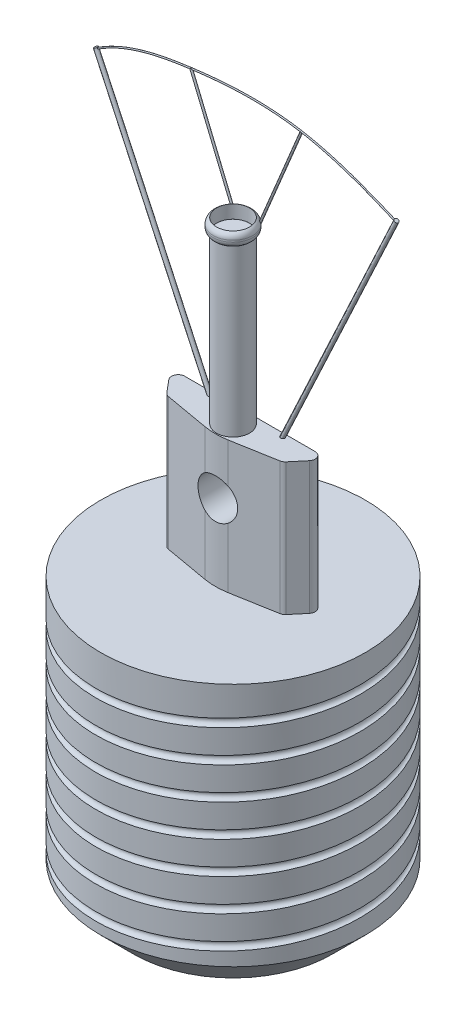
from build123d import *

# Parameters (mm, degrees)
SKETCH1_R           = 20
BOSS_EXTRUDE1_DEPTH = 40
CUT_SWEEP1_PITCH    = 4.875
SKETCH4_R           = 20
BOSS_EXTRUDE2_DEPTH = 2
BOSS_EXTRUDE3_DEPTH = 20
SKETCH6_R           = 3
CUT_EXTRUDE1_DEPTH  = 69.93969835
SKETCH7_R           = 2.5
BOSS_EXTRUDE4_DEPTH = 25
SKETCH8_R           = 3
SKETCH8_R_2         = 2.5
BOSS_EXTRUDE5_DEPTH = 2
FILLET3_R           = 10
FILLET1_R           = 1
SKETCH11_R          = 0.3
SKETCH14_R          = 4
BOSS_EXTRUDE6_DEPTH = 3
CHAMFER1_SIZE       = 5
SKETCH16_R          = 0.15
SKETCH18_R          = 0.1
CHAMFER2_SIZE       = 2
FILLET4_R           = 1


with BuildPart() as part:
    # Sketch1 → Boss-Extrude1 (new body)
    with BuildSketch(Plane(origin=(0, 0, 0), x_dir=(1, 0, 0), z_dir=(0, 1, 0))):
        with Locations(Location((0, 0, 0), (0, 0, 270))):
            Circle(SKETCH1_R)
    extrude(amount=BOSS_EXTRUDE1_DEPTH)

    # Cut-Sweep1: the profile of Sketch3 screwed along a right-hand helix of 8 turns, 12 arcs to a turn; built about Z, then put on its axis
    cut_sweep1_z = Axis((0, 0, 0), (0, 0, 1))
    cut_sweep1_corners = [(20.625, 0, 0), (20, 0.024848298, -0.624505854), (19.375, 0, 0), (20, -0.024848298, 0.624505854)]
    with BuildLine(mode=Mode.PRIVATE) as cut_sweep1_profile:
        ThreePointArc((20.625, 0, 0), (20.441941738, 0.0175704, -0.441592324), (20, 0.024848298, -0.624505854))
        ThreePointArc((20, 0.024848298, -0.624505854), (19.558058262, 0.0175704, -0.441592324), (19.375, 0, 0))
        ThreePointArc((19.375, 0, 0), (19.558058262, -0.0175704, 0.441592324), (20, -0.024848298, 0.624505854))
        ThreePointArc((20, -0.024848298, 0.624505854), (20.441941738, -0.0175704, 0.441592324), (20.625, 0, 0))
    cut_sweep1_cap = Face(cut_sweep1_profile.wire())
    cut_sweep1_arcs = [((20.625, 0, 0), (20.625, 0.024848298, -0.624505854), (20, 0.024848298, -0.624505854), (1, 0.7071067811865475, 1)), ((20, 0.024848298, -0.624505854), (19.375, 0.024848298, -0.624505854), (19.375, 0, 0), (1, 0.7071067811865475, 1)), ((19.375, 0, 0), (19.375, -0.024848298, 0.624505854), (20, -0.024848298, 0.624505854), (1, 0.7071067811865475, 1)), ((20, -0.024848298, 0.624505854), (20.625, -0.024848298, 0.624505854), (20.625, 0, 0), (1, 0.7071067811865475, 1))]  # start, shoulder, end, weights
    cut_sweep1_turn_angles = [0, 15, 30, 45, 60, 75, 90, 105, 120, 135, 150, 165, 180, 195, 210, 225, 240, 255, 270, 285, 300, 315, 330, 345, 360]
    cut_sweep1_turn_weights = [1, 0.9659258262890683, 1, 0.9659258262890683, 1, 0.9659258262890683, 1, 0.9659258262890683, 1, 0.9659258262890683, 1, 0.9659258262890683, 1, 0.9659258262890683, 1, 0.9659258262890683, 1, 0.9659258262890683, 1, 0.9659258262890683, 1, 0.9659258262890683, 1, 0.9659258262890683, 1]
    cut_sweep1_turn_sides = [Face.make_bezier_surface([[Vector(p[j][0], p[j][1], 0).rotate(cut_sweep1_z, cut_sweep1_turn_angles[2 * i + k]) / cut_sweep1_turn_weights[2 * i + k] + Vector(0, 0, p[j][2] + CUT_SWEEP1_PITCH * cut_sweep1_turn_angles[2 * i + k] / 360) for k in range(3)] for j in range(3)], [[p[3][j] * cut_sweep1_turn_weights[2 * i + k] for k in range(3)] for j in range(3)]) for p in cut_sweep1_arcs for i in range(12)]
    cut_sweep1 = Plane(origin=(0, 40, 0), x_dir=(-1, 0, 0), z_dir=(0, -1, 0)) * Solid(Shell([*[p.moved(Location((0, 0, CUT_SWEEP1_PITCH * i))) for i in range(8) for p in cut_sweep1_turn_sides], cut_sweep1_cap, cut_sweep1_cap.rotate(cut_sweep1_z, 2880).moved(Location((0, 0, CUT_SWEEP1_PITCH * 2880 / 360)))]))
    add(cut_sweep1, mode=Mode.SUBTRACT)

    # Sketch4 → Boss-Extrude2 (add)
    with BuildSketch(Plane(origin=(0, 40, 0), x_dir=(1, 0, 0), z_dir=(0, 1, 0))):
        with Locations(Location((0, 0, 0), (0, 0, 270))):
            Circle(SKETCH4_R)
    extrude(amount=BOSS_EXTRUDE2_DEPTH)

    # Sketch5 → Boss-Extrude3 (add)
    with BuildSketch(Plane(origin=(0, 42, 0), x_dir=(1, 0, 0), z_dir=(0, 1, 0))):
        with BuildLine():
            Line((9.855493079, 2.553979695), (-9.855493079, 2.553979695))
            ThreePointArc((-9.855493079, 2.553979695), (-10.761800867, 1.976597957), (-10.621537523, 0.911192085))
            Line((-10.621537523, 0.911192085), (-9.020017508, -0.997425145))
            ThreePointArc((-9.020017508, -0.997425145), (-8.753973065, -1.220662939), (-8.427621243, -1.339445289))
            Line((-8.427621243, -1.339445289), (0, -2.825462297))
            Line((0, -2.825462297), (8.427621243, -1.339445289))
            ThreePointArc((8.427621243, -1.339445289), (8.753973065, -1.220662939), (9.020017508, -0.997425145))
            Line((9.020017508, -0.997425145), (10.621537523, 0.911192085))
            ThreePointArc((10.621537523, 0.911192085), (10.761800867, 1.976597957), (9.855493079, 2.553979695))
        make_face()
    extrude(amount=BOSS_EXTRUDE3_DEPTH)

    # Sketch6 → Cut-Extrude1 (cut, through all)
    with BuildSketch(Plane(origin=(0, 0, -2.553979695), x_dir=(-1, 0, 0), z_dir=(0, 0, -1))):
        with Locations((0, 53.52029527)):
            Circle(SKETCH6_R)
    extrude(amount=-CUT_EXTRUDE1_DEPTH, mode=Mode.SUBTRACT)

    # Sketch7 → Boss-Extrude4 (add)
    with BuildSketch(Plane(origin=(0, 62, 0), x_dir=(1, 0, 0), z_dir=(0, 1, 0))):
        with Locations(Location((0, 0, 0), (0, 0, 270))):
            Circle(SKETCH7_R)
    extrude(amount=BOSS_EXTRUDE4_DEPTH)

    # Fillet3
    fillet3_edges = [part.edges().sort_by_distance(p)[0] for p in [
        (0, 46.260147635, 2.825462297),
        (0, 59.260147635, 2.825462297),
    ]]
    fillet(fillet3_edges, radius=FILLET3_R)

    # Sweep1: sweep along a path in Sketch10
    with BuildLine(Plane.XY.offset(-2)) as sweep1_path:
        Line((-4.417969366, 59.661911839), (-22.732460557, 98.937464943))
    # Sketch11 → Sweep1 (sweep)
    with BuildSketch(Plane(origin=(-22.732460557, 98.937464943, -2), x_dir=(0.9063077870366525, 0.42261826174069395, 0), z_dir=(-0.42261826174069395, 0.9063077870366525, 0))):
        Circle(SKETCH11_R)
    sweep1 = sweep(path=sweep1_path.line)

    # Mirror1: Sweep1 across plane
    add(sweep1.mirror(Plane(origin=(0, 0, 0), x_dir=(0, 0, 1), z_dir=(1, 0, 0))))

    # Sketch14 → Boss-Extrude6 (add)
    with BuildSketch(Plane.XZ):
        with Locations(Location((0, 0, 0), (0, 0, 90))):
            Circle(SKETCH14_R)
    extrude(amount=BOSS_EXTRUDE6_DEPTH)

    # Chamfer1
    # the kernel refuses this chamfer: 5 mm, written as the material it takes off along each edge
    with BuildSketch(Plane(origin=(0, 0, 0), x_dir=(0, 0, 1), z_dir=(-1, 0, 0))) as chamfer1_piece_1:
        Polygon((20, CHAMFER1_SIZE), (20 - CHAMFER1_SIZE, 0), (20, 0), align=None)
    revolve(axis=Axis((0, 0, 0), (0, 1, 0)), mode=Mode.SUBTRACT)

    # Sweep6: sweep along a path in Sketch17
    with BuildLine() as sweep6_path:  # in the path sketch's own coordinates; laid on its plane below (add() does not lay a ready-made edge on the line's plane)
        add(Edge.make_bspline(
            [(-22.677657355, 98.7761759), (-18.410883671, 101.6335652), (-8.009838198, 103.805909791), (7.885759174, 104.639553389), (18.025435265, 100.750522625), (22.64813584, 98.7761759)],
            knots=[0, 0, 0, 0, 0.31992603, 0.676007403, 1, 1, 1, 1], degree=3))
    # Sketch18 → Sweep6 (sweep)
    with BuildSketch(Plane(origin=(-22.677657355, 98.7761759, -2), x_dir=(0, 0, -1), z_dir=(0.8308914410553971, 0.5564345542657155, 0))):
        Circle(SKETCH18_R)
    sweep(path=Plane.XY.offset(-2) * sweep6_path.line)

    # Chamfer2
    chamfer2_edges = [part.edges().sort_by_distance(p)[0] for p in [
        (0, -3, -4),
    ]]
    chamfer(chamfer2_edges, length=CHAMFER2_SIZE)

    # Fillet4
    fillet4_edges = [part.edges().sort_by_distance(p)[0] for p in [
        (0, -3, -2),
    ]]
    fillet(fillet4_edges, radius=FILLET4_R)


with BuildPart() as body_2:
    # Sketch8 → Boss-Extrude5 (new body)
    with BuildSketch(Plane(origin=(0, 87, 0), x_dir=(1, 0, 0), z_dir=(0, 1, 0))):
        with Locations(Location((0, 0, 0), (0, 0, 270))):
            Circle(SKETCH8_R)
        with Locations(Location((0, 0, 0), (0, 0, 270))):
            Circle(SKETCH8_R_2, mode=Mode.SUBTRACT)
    extrude(amount=BOSS_EXTRUDE5_DEPTH)

    # Fillet1
    # the kernel refuses this fillet: 1 mm, written as the material it takes off along each edge
    with BuildSketch(Plane(origin=(0, 87, 0), x_dir=(0, 0, 1), z_dir=(-1, 0, 0))) as fillet1_piece_1:
        with BuildLine():
            CenterArc((2, 0.866025404), FILLET1_R, 300, 60)
            Line((2.5, 0), (2.51, -0.017320508))
            ThreePointArc((2.51, -0.017320508), (2.75, -0.02), (3, -0.02))
            Line((3, -0.02), (3.02, 0))
            Line((3.02, 0), (3.02, 0.866025404))
            Line((3.02, 0.866025404), (3, 0.866025404))
        make_face()
    revolve(axis=Axis((0, 87, 0), (0, 1, 0)), mode=Mode.SUBTRACT)
    with BuildSketch(Plane(origin=(0, 89, 0), x_dir=(0, 0, 1), z_dir=(-1, 0, 0))) as fillet1_piece_2:
        with BuildLine():
            CenterArc((2, -0.866025404), FILLET1_R, 0, 60)
            Line((2.5, 0), (2.51, 0.017320508))
            ThreePointArc((2.51, 0.017320508), (2.75, 0.02), (3, 0.02))
            Line((3, 0.02), (3.02, 0))
            Line((3.02, 0), (3.02, -0.866025404))
            Line((3.02, -0.866025404), (3, -0.866025404))
        make_face()
    revolve(axis=Axis((0, 89, 0), (0, 1, 0)), mode=Mode.SUBTRACT)

    # Sweep2: sweep along a path in Sketch15
    with BuildLine(Plane.XY.offset(-2)) as sweep2_path:
        Line((-2, 88.133974596), (-8.350488632, 103.387051607))
    # Sketch16 → Sweep2 (sweep)
    with BuildSketch(Plane(origin=(-8.350488632, 103.387051607, -2), x_dir=(0.9231834705165758, 0.3843595709293195, 0), z_dir=(-0.3843595709293195, 0.9231834705165758, 0))):
        Circle(SKETCH16_R)
    sweep2 = sweep(path=sweep2_path.line)

    # Mirror2: Sweep2 across plane
    add(sweep2.mirror(Plane(origin=(0, 0, 0), x_dir=(0, 0, 1), z_dir=(1, 0, 0))))


solid = Compound([part.part, body_2.part])
